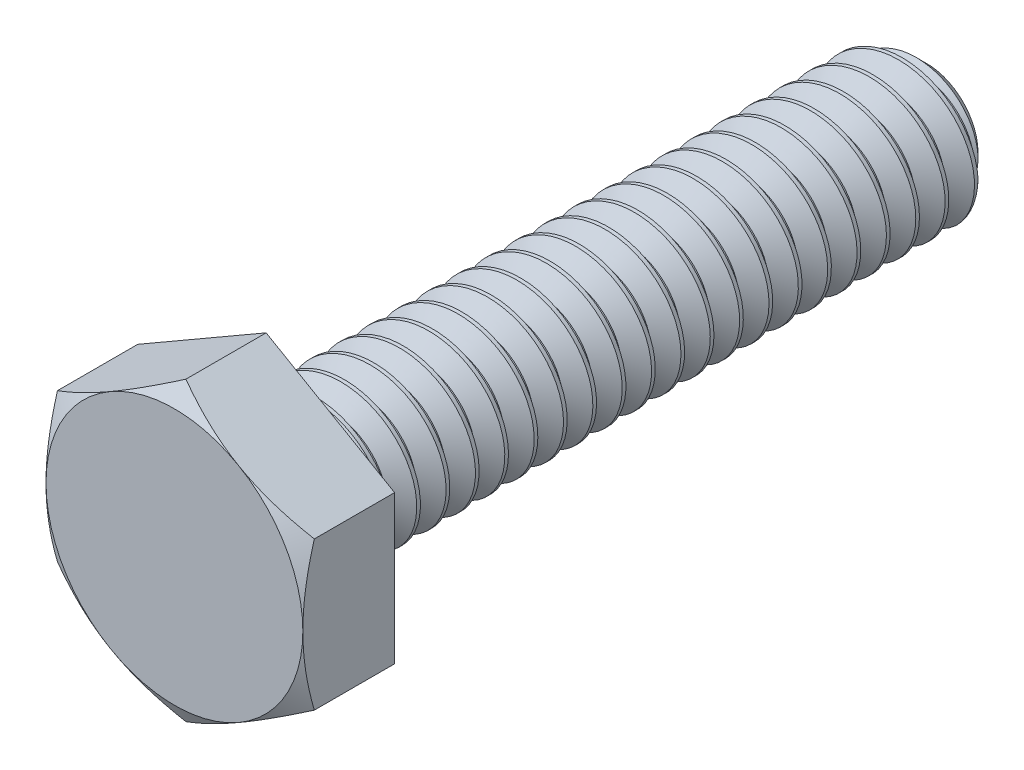
from build123d import *

# Parameters (mm, degrees)
SKETCH2_W           = 28.575
SKETCH2_H           = 3.175
BOSS_EXTRUDE1_DEPTH = 3.96875
CHAMFER1_SIZE       = 0.9525
SKETCH4_OUTSIDE_W   = 140.422
SKETCH4_OUTSIDE_H   = 142.142
SKETCH4_OUTSIDE_R   = 5.55625
CUT_EXTRUDE1_DEPTH  = 34.6322781
CUT_EXTRUDE1_DRAFT  = -60
CUT_SWEEP1_PITCH    = 1.27
CUT_SWEEP1_TO       = 28.575


with BuildPart() as part:
    # Sketch2 → Revolve1 (revolve)
    with BuildSketch(Plane(origin=(0, 0, 0), x_dir=(0, 0, -1), z_dir=(1, 0, 0)), mode=Mode.PRIVATE) as revolve1_sk:
        with Locations((14.2875, 1.5875)):
            Rectangle(SKETCH2_W, SKETCH2_H)
    revolve(revolve1_sk.sketch.rotate(Axis((0, 0, 0), (0, 0, -1)), 90), axis=Axis((0, 0, 0), (0, 0, -1)))

    # Sketch3 → Boss-Extrude1 (add)
    with BuildSketch(Plane.XY):
        Polygon((0, 6.415804866), (-5.55625, 3.207902433), (-5.55625, -3.207902433), (0, -6.415804866), (5.55625, -3.207902433), (5.55625, 3.207902433), align=None)
    extrude(amount=BOSS_EXTRUDE1_DEPTH)

    # Chamfer1
    chamfer1_edges = [part.edges().sort_by_distance(p)[0] for p in [
        (-3.175, 0, -28.575),
    ]]
    chamfer(chamfer1_edges, length=CHAMFER1_SIZE)


with BuildPart() as cut_extrude1_tool:
    # Sketch4 outside → Cut-Extrude1 (with draft: the straight prism first)
    with BuildSketch(Plane.XY.offset(3.96875)):
        Rectangle(SKETCH4_OUTSIDE_W, SKETCH4_OUTSIDE_H)
        Circle(SKETCH4_OUTSIDE_R, mode=Mode.SUBTRACT)
    extrude(amount=-CUT_EXTRUDE1_DEPTH)
    # Cut-Extrude1: the draft: its side faces are tilted about the plane it starts from
    cut_extrude1_sides = [cut_extrude1_tool.faces().sort_by_distance(p)[0] for p in [
        (0, -71.071, -13.34738905),
        (70.211, 0, -13.34738905),
        (0, 71.071, -13.34738905),
        (-70.211, 0, -13.34738905),
        (-5.55625, 0, -13.34738905),
    ]]
    draft(cut_extrude1_sides, Plane.XY.offset(3.96875), CUT_EXTRUDE1_DRAFT)


with BuildPart() as part_1:
    add(part.part)

    # Cut-Extrude1: cut by cut_extrude1_tool
    add(cut_extrude1_tool.part, mode=Mode.SUBTRACT)


with BuildPart() as body_2:
    # Split1: read off the stored shape, not the designer's step
    # Split1: the piece on the far side of the plane
    add(part_1.part)
    split(bisect_by=Plane.XY, keep=Keep.BOTTOM)

    # Cut-Sweep1: arcs per turn and ends read off the stored shape
    # Cut-Sweep1: the profile of Sketch5 screwed along a right-hand helix through 23.5 turns, 8 arcs to a turn; built about Z, then put on its axis
    cut_sweep1_z = Axis((0, 0, 0), (0, 0, 1))
    cut_sweep1_corners = [(3.243740766, 0, 0.0396875), (3.243740766, 0, -1.1509375), (2.350110803, 0, -0.635), (2.350110803, 0, -0.47625)]
    with BuildLine(mode=Mode.PRIVATE) as cut_sweep1_profile:
        Line(cut_sweep1_corners[0], cut_sweep1_corners[1])
        Line(cut_sweep1_corners[1], cut_sweep1_corners[2])
        Line(cut_sweep1_corners[2], cut_sweep1_corners[3])
        Line(cut_sweep1_corners[3], cut_sweep1_corners[0])
    cut_sweep1_cap = Face(cut_sweep1_profile.wire())
    cut_sweep1_turn_angles = [0, 22.5, 45, 67.5, 90, 112.5, 135, 157.5, 180, 202.5, 225, 247.5, 270, 292.5, 315, 337.5, 360]
    cut_sweep1_turn_weights = [1, 0.9238795325112867, 1, 0.9238795325112867, 1, 0.9238795325112867, 1, 0.9238795325112867, 1, 0.9238795325112867, 1, 0.9238795325112867, 1, 0.9238795325112867, 1, 0.9238795325112867, 1]
    cut_sweep1_turn_rails = [Edge.make_bspline([Vector(p[0], p[1], 0).rotate(cut_sweep1_z, cut_sweep1_turn_angles[k]) / cut_sweep1_turn_weights[k] + Vector(0, 0, p[2] + CUT_SWEEP1_PITCH * cut_sweep1_turn_angles[k] / 360) for k in range(17)], [0, 0, 0, 1, 1, 2, 2, 3, 3, 4, 4, 5, 5, 6, 6, 7, 7, 8, 8, 8], 2, cut_sweep1_turn_weights) for p in cut_sweep1_corners]
    cut_sweep1_turn_sides = [Face.make_surface_from_curves(cut_sweep1_turn_rails[p[0]], cut_sweep1_turn_rails[p[1]]) for p in [(0, 1), (1, 2), (2, 3), (3, 0)]]
    cut_sweep1_last_angles = [8280, 8302.5, 8325, 8347.5, 8370, 8392.5, 8415, 8437.5, 8460]
    cut_sweep1_last_weights = [1, 0.9238795325112867, 1, 0.9238795325112867, 1, 0.9238795325112867, 1, 0.9238795325110802, 1]
    cut_sweep1_last_rails = [Edge.make_bspline([Vector(p[0], p[1], 0).rotate(cut_sweep1_z, cut_sweep1_last_angles[k]) / cut_sweep1_last_weights[k] + Vector(0, 0, p[2] + CUT_SWEEP1_PITCH * cut_sweep1_last_angles[k] / 360) for k in range(9)], [0, 0, 0, 1, 1, 2, 2, 3, 3, 4, 4, 4], 2, cut_sweep1_last_weights) for p in cut_sweep1_corners]
    cut_sweep1_last_sides = [Face.make_surface_from_curves(cut_sweep1_last_rails[p[0]], cut_sweep1_last_rails[p[1]]) for p in [(0, 1), (1, 2), (2, 3), (3, 0)]]
    cut_sweep1 = Plane(origin=(0, 0, -28.575), x_dir=(0, 1, 0), z_dir=(0, 0, 1)) * split(Solid(Shell([*[p.moved(Location((0, 0, CUT_SWEEP1_PITCH * i))) for i in range(23) for p in cut_sweep1_turn_sides], *cut_sweep1_last_sides, cut_sweep1_cap, cut_sweep1_cap.rotate(cut_sweep1_z, 8460).moved(Location((0, 0, CUT_SWEEP1_PITCH * 8460 / 360)))])), bisect_by=Plane.XY.offset(CUT_SWEEP1_TO), keep=Keep.BOTTOM, mode=Mode.PRIVATE)
    add(cut_sweep1, mode=Mode.SUBTRACT)


with BuildPart() as part_2:
    add(part_1.part)

    # Split1
    split(bisect_by=Plane.XY, keep=Keep.TOP)

    # Combine1: union body 2
    add(body_2.part)


solid = part_2.part
